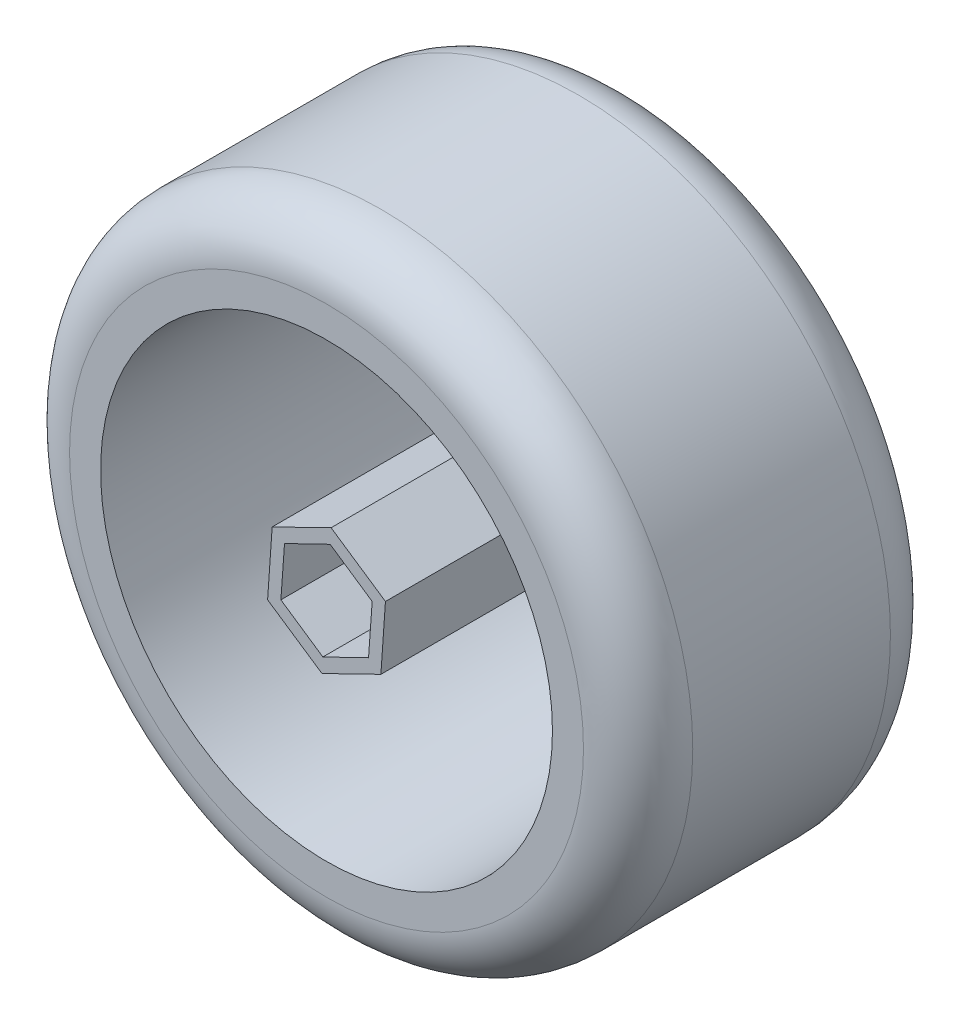
from build123d import *

# Parameters (mm, degrees)
SKETCH1_R           = 42.545
BOSS_EXTRUDE1_DEPTH = 41.91
CUT_EXTRUDE1_DEPTH  = 74.325317251
FILLET1_R           = 7.46
SKETCH3_R           = 30.849176173
CUT_EXTRUDE2_DEPTH  = 74.325317251


with BuildPart() as part:
    # Sketch1 → Boss-Extrude1 (new body)
    with BuildSketch(Plane.XY):
        Circle(SKETCH1_R)
    extrude(amount=BOSS_EXTRUDE1_DEPTH)

    # Sketch2 → Cut-Extrude1 (cut, through all)
    with BuildSketch(Plane.XY.offset(41.91)):
        Polygon((6.233776944, 3.023247428), (0.498679397, 6.910232909), (-5.735097547, 3.886985481), (-6.233776944, -3.023247428), (-0.498679397, -6.910232909), (5.735097547, -3.886985481), align=None)
    extrude(amount=-CUT_EXTRUDE1_DEPTH, mode=Mode.SUBTRACT)

    # Fillet1
    fillet1_edges = [part.edges().sort_by_distance(p)[0] for p in [
        (-42.545, 0, 0),
        (-42.545, 0, 41.91),
    ]]
    fillet(fillet1_edges, radius=FILLET1_R)

    # Sketch3 → Cut-Extrude2 (cut, through all)
    with BuildSketch(Plane.XY.offset(41.91)):
        Circle(SKETCH3_R)
        Polygon((0.622447906, 8.929854653), (-7.422257028, 5.003983026), (-8.044704934, -3.925871627), (-0.622447906, -8.929854653), (7.422257028, -5.003983026), (8.044704934, 3.925871627), align=None, mode=Mode.SUBTRACT)
    extrude(amount=-CUT_EXTRUDE2_DEPTH, mode=Mode.SUBTRACT)


with BuildPart() as cut_extrude2_piece_1:
    # of the separate pieces the step leaves, piece 1, a body of its own (cut_extrude2_pieces)
    add(part.part.solids().sort_by_distance((42.545, 0, 7.46))[0])


with BuildPart() as cut_extrude2_piece_2:
    # of the separate pieces the step leaves, piece 2, a body of its own (cut_extrude2_pieces)
    add(part.part.solids().sort_by_distance((7.422257028, -5.003983026, 0))[0])


solid = Compound([cut_extrude2_piece_1.part, cut_extrude2_piece_2.part])
